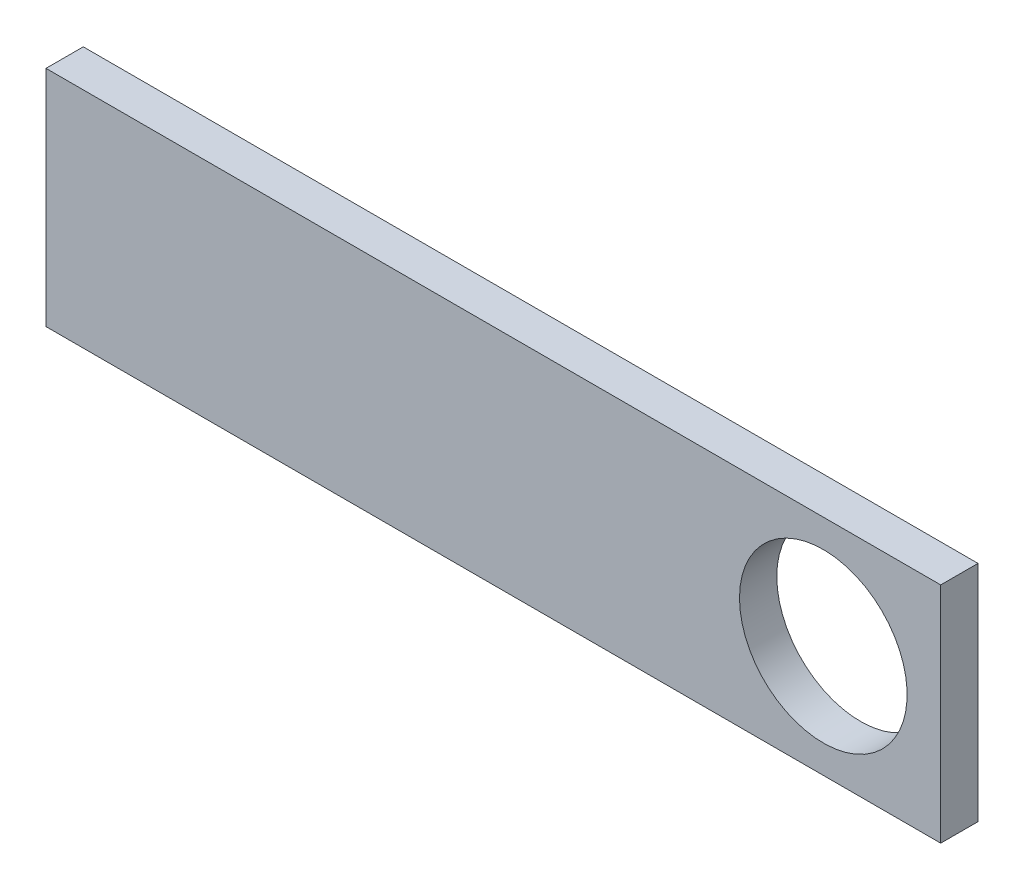
from build123d import *

# Parameters (mm, degrees)
SKETCH1_W           = 152.4
SKETCH1_H           = 38.1
BOSS_EXTRUDE1_DEPTH = 6.35
SKETCH2_R           = 14.275
CUT_EXTRUDE1_DEPTH  = 158.21861372


with BuildPart() as part:
    # Sketch1 → Boss-Extrude1 (new body)
    with BuildSketch(Plane.XY):
        with Locations((76.2, -19.05)):
            Rectangle(SKETCH1_W, SKETCH1_H)
    extrude(amount=BOSS_EXTRUDE1_DEPTH)

    # Sketch2 → Cut-Extrude1 (cut, through all)
    with BuildSketch(Plane(origin=(0, 0, 0), x_dir=(-1, 0, 0), z_dir=(0, 0, -1))):
        with Locations((-132.4, -19.05)):
            Circle(SKETCH2_R)
    extrude(amount=-CUT_EXTRUDE1_DEPTH, mode=Mode.SUBTRACT)


solid = part.part
